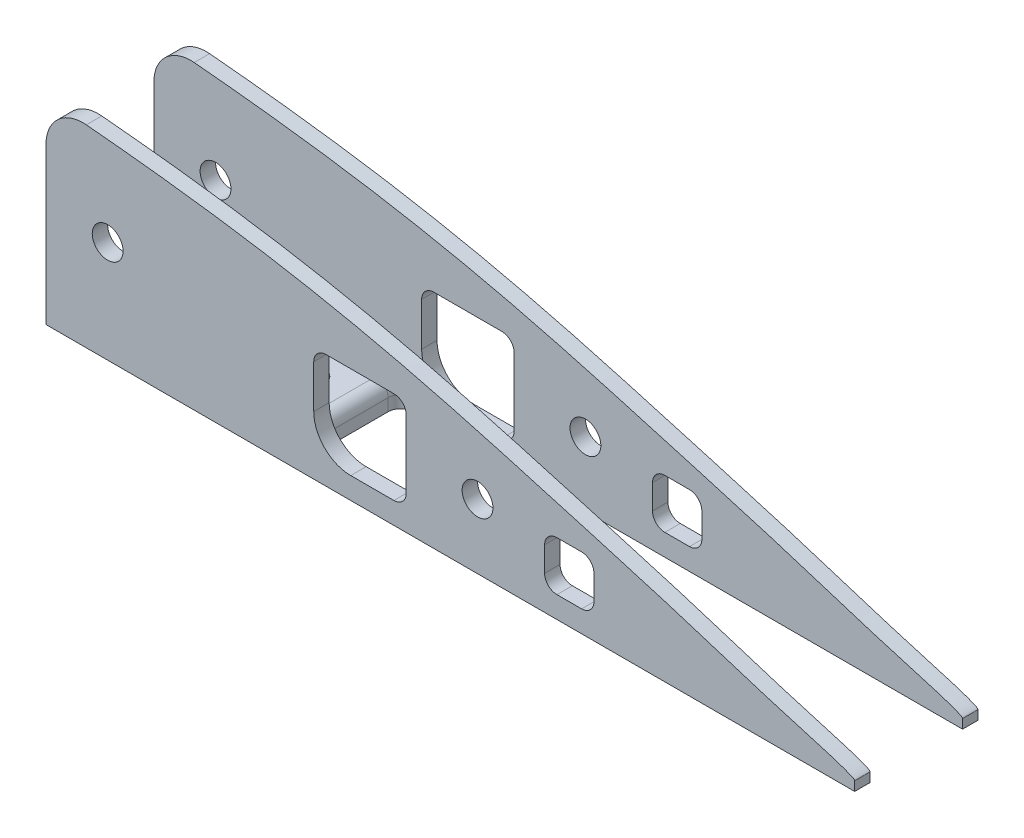
from build123d import *

# Parameters (mm, degrees)
BOSS_EXTRUDE1_DEPTH       = 12.7
BOSS_EXTRUDE1_DEPTH_BACK  = 12.7
SKETCH2_W                 = 19.05
SKETCH2_H                 = 49.651656102
CUT_EXTRUDE1_DEPTH        = 310.423757716
BOSS_EXTRUDE2_OUTLINE_W   = 38.1
BOSS_EXTRUDE2_OUTLINE_H   = 5.044027725
BOSS_EXTRUDE2_OUTLINE_W_2 = 19.05
BOSS_EXTRUDE2_DEPTH       = 19.05
CUT_EXTRUDE3_DEPTH        = 50.8
CUT_EXTRUDE3_DEPTH_BACK   = 50.8
SKETCH12_R                = 9.525
SKETCH12_R_2              = 3.175
SKETCH12_R_3              = 5
FILLET8_R                 = 2.54
SKETCH13_R                = 9.525
SKETCH13_R_2              = 5
CUT_EXTRUDE4_DEPTH        = 311.204708703
CUT_EXTRUDE5_DEPTH        = 309.603621169
CUT_EXTRUDE5_DEPTH_BACK   = 309.603621169
SKETCH14_R                = 3.175
FILLET9_R                 = 7.62
SKETCH16_W                = 19.05
SKETCH16_H                = 19.05
SKETCH16_W_2              = 10.16
SKETCH16_H_2              = 10.16
CUT_EXTRUDE6_DEPTH        = 1693.418
FILLET10_R                = 7.62
FILLET11_R                = 2.54


# Read off the part's stored shape, not the designer's step: Boss-Extrude2
with BuildPart() as part:
    # Sketch1 → Boss-Extrude1 (new, two sides: drawn at the far end of the back side and taken through both)
    with BuildSketch(Plane.XY.offset(-BOSS_EXTRUDE1_DEPTH_BACK)):
        with BuildLine():
            Line((306.2918866, 1.929193729), (306.2918866, 0.035972275))
            Line((306.2918866, 0.035972275), (18.385743088, 0.035972275))
            add(Edge.make_bspline(
                [(306.2918866, 1.929193729), (306.565703117, 2.60439044), (288.5800577, 7.542224382), (271.922557924, 13.119693618), (244.545512993, 21.039717296), (214.63705438, 29.578808281), (183.74892315, 35.843363942), (153.039666672, 39.584058053), (122.364389131, 41.910380286), (91.676834287, 42.234137684), (66.092232531, 40.375185886), (45.725322729, 37.15263137), (32.792424184, 34.392213233), (22.784634494, 30.143895353), (14.954380304, 26.333975955), (8.569620221, 21.769960087), (2.606076707, 16.225698301), (-1.858362456, 8.564778309), (3.017819974, 2.013571533), (8.993020993, 0.344786487), (13.886881629, 0.072440703), (17.418928388, 0.035163036), (18.385743088, 0.035972275)],
                knots=[0, 0, 0, 0, 0.025556044, 0.050960447, 0.101552747, 0.151805438, 0.201252492, 0.250083002, 0.298629141, 0.347026117, 0.395536064, 0.420002519, 0.444885368, 0.457915187, 0.471441031, 0.48620838, 0.494593531, 0.510948222, 0.521394631, 0.527823606, 0.539981828, 0.544566103, 0.544566103, 0.544566103, 0.544566103], degree=3))
        make_face()
    extrude(amount=BOSS_EXTRUDE1_DEPTH + BOSS_EXTRUDE1_DEPTH_BACK)

    # Sketch2 → Cut-Extrude1 (cut, through all)
    with BuildSketch(Plane(origin=(0, 0, 0), x_dir=(0, 0, -1), z_dir=(1, 0, 0))):
        with Locations((0, 22.711736939)):
            Rectangle(SKETCH2_W, SKETCH2_H)
    extrude(amount=CUT_EXTRUDE1_DEPTH, mode=Mode.SUBTRACT)


with BuildPart() as cut_extrude1_piece_1:
    # of the separate pieces the step leaves, piece 1, a body of its own (cut_extrude1_pieces)
    add(part.part.solids().sort_by_distance((306.2918866, 0.035972275, 9.525))[0])



with BuildPart() as cut_extrude1_piece_2:
    # of the separate pieces the step leaves, piece 2, a body of its own (cut_extrude1_pieces)
    add(part.part.solids().sort_by_distance((306.2918866, 1.929193729, -9.525))[0])


with BuildPart() as cut_extrude1_piece_1_1:
    add(cut_extrude1_piece_1.part)

    add(cut_extrude1_piece_2.part)  # Boss-Extrude2 merges Cut-Extrude1 piece 2
    # Boss-Extrude2 outline → Boss-Extrude2 (add)
    with BuildSketch(Plane.XY.offset(-9.525)):
        with Locations((50.8, 2.557986137)):
            Rectangle(BOSS_EXTRUDE2_OUTLINE_W, BOSS_EXTRUDE2_OUTLINE_H)
        with Locations((180.975, 2.557986137)):
            Rectangle(BOSS_EXTRUDE2_OUTLINE_W_2, BOSS_EXTRUDE2_OUTLINE_H)
    extrude(amount=BOSS_EXTRUDE2_DEPTH)

    # Sketch12 → Cut-Extrude3 (cut, two sides: drawn at the far end of the back side and taken through both)
    with BuildSketch(Plane.XY.offset(-CUT_EXTRUDE3_DEPTH_BACK)):
        with Locations(Location((82.55, 21.048356458, 0), (0, 0, 180))):
            Circle(SKETCH12_R)
        with Locations(Location((152.4, 21.048356458, 0), (0, 0, 180))):
            Circle(SKETCH12_R_2)
        with Locations(Location((228.6, 13.349794258, 0), (0, 0, 180))):
            Circle(SKETCH12_R_2)
        with Locations(Location((117.475, 21.048356458, 0), (0, 0, 180))):
            Circle(SKETCH12_R_3)
    extrude(amount=CUT_EXTRUDE3_DEPTH + CUT_EXTRUDE3_DEPTH_BACK, mode=Mode.SUBTRACT)

    # Fillet8
    fillet8_edges = [cut_extrude1_piece_1_1.edges().sort_by_distance(p)[0] for p in [
        (50.8, 5.08, -9.525),
        (69.85, 2.557986138, -9.525),
        (50.8, 5.08, 9.525),
        (69.85, 2.557986138, 9.525),
        (171.45, 2.557986138, -9.525),
        (171.45, 5.08, 0),
        (180.975, 5.08, 9.525),
        (190.5, 5.08, 0),
        (180.975, 5.08, -9.525),
        (190.5, 2.557986138, 9.525),
        (190.5, 2.557986138, -9.525),
        (171.45, 2.557986138, 9.525),
        (69.85, 5.08, 0),
        (31.75, 2.557986138, 9.525),
        (31.75, 5.08, 0),
        (31.75, 2.557986138, -9.525),
    ]]
    fillet(fillet8_edges, radius=FILLET8_R)

    # Sketch13 → Cut-Extrude4 (cut, through all)
    with BuildSketch(Plane.XY.offset(12.7)):
        with BuildLine():
            Line((18.385743088, 0.035972275), (139.7, 0.035972275))
            Line((139.7, 0.035972275), (139.7, 40.526097112))
            add(Edge.make_bspline(
                [(139.7, 40.526097112), (133.912966058, 40.971759709), (117.928487598, 41.957179581), (91.676834287, 42.234137684), (66.092232531, 40.375185886), (45.725322729, 37.15263137), (32.792424184, 34.392213233), (22.784634494, 30.143895353), (14.954380304, 26.333975955), (8.569620221, 21.769960087), (2.606076707, 16.225698301), (-1.858362456, 8.564778309), (3.017819974, 2.013571533), (8.993020993, 0.344786487), (13.886881629, 0.072440703), (17.418928388, 0.035163036), (18.385743088, 0.035972275)],
                knots=[0.271108315, 0.271108315, 0.271108315, 0.271108315, 0.298629141, 0.347026117, 0.395536064, 0.420002519, 0.444885368, 0.457915187, 0.471441031, 0.48620838, 0.494593531, 0.510948222, 0.521394631, 0.527823606, 0.539981828, 0.544566103, 0.544566103, 0.544566103, 0.544566103], degree=3))
        make_face()
        with Locations((82.55, 21.048356458)):
            Circle(SKETCH13_R, mode=Mode.SUBTRACT)
        with Locations((117.475, 21.048356458)):
            Circle(SKETCH13_R_2, mode=Mode.SUBTRACT)
    extrude(amount=-CUT_EXTRUDE4_DEPTH, mode=Mode.SUBTRACT)

    # Sketch14 → Cut-Extrude5 (cut, two sides: drawn at the far end of the back side and taken through both)
    with BuildSketch(Plane(origin=(0, 5.08, 0), x_dir=(1, 0, 0), z_dir=(0, 1, 0)).offset(-CUT_EXTRUDE5_DEPTH_BACK)):
        with Locations((180.975, 0)):
            Circle(SKETCH14_R)
    extrude(amount=CUT_EXTRUDE5_DEPTH + CUT_EXTRUDE5_DEPTH_BACK, mode=Mode.SUBTRACT)

    # Fillet9
    fillet9_edges = [cut_extrude1_piece_1_1.edges().sort_by_distance(p)[0] for p in [
        (139.7, 40.526097112, 11.1125),
        (139.7, 40.526097112, -11.1125),
    ]]
    fillet(fillet9_edges, radius=FILLET9_R)

    # Sketch16 → Cut-Extrude6 (cut)
    with BuildSketch(Plane.XY.offset(12.7)):
        with Locations((204.382492583, 14.012712879)):
            Rectangle(SKETCH16_W, SKETCH16_H)
        with Locations((247.498903959, 9.567712879)):
            Rectangle(SKETCH16_W_2, SKETCH16_H_2)
    extrude(amount=-CUT_EXTRUDE6_DEPTH, mode=Mode.SUBTRACT)

    # Fillet10
    fillet10_edges = [cut_extrude1_piece_1_1.edges().sort_by_distance(p)[0] for p in [
        (194.857492583, 4.487712879, -11.1125),
        (194.857492583, 4.487712879, 11.1125),
    ]]
    fillet(fillet10_edges, radius=FILLET10_R)

    # Fillet11
    fillet11_edges = [cut_extrude1_piece_1_1.edges().sort_by_distance(p)[0] for p in [
        (194.857492583, 23.537712879, -11.1125),
        (213.907492583, 23.537712879, -11.1125),
        (213.907492583, 4.487712879, -11.1125),
        (194.857492583, 23.537712879, 11.1125),
        (213.907492583, 23.537712879, 11.1125),
        (213.907492583, 4.487712879, 11.1125),
        (242.418903959, 4.487712879, -11.1125),
        (242.418903959, 14.647712879, -11.1125),
        (252.578903959, 14.647712879, -11.1125),
        (252.578903959, 4.487712879, -11.1125),
        (242.418903959, 4.487712879, 11.1125),
        (242.418903959, 14.647712879, 11.1125),
        (252.578903959, 14.647712879, 11.1125),
        (252.578903959, 4.487712879, 11.1125),
    ]]
    fillet(fillet11_edges, radius=FILLET11_R)


solid = cut_extrude1_piece_1_1.part
